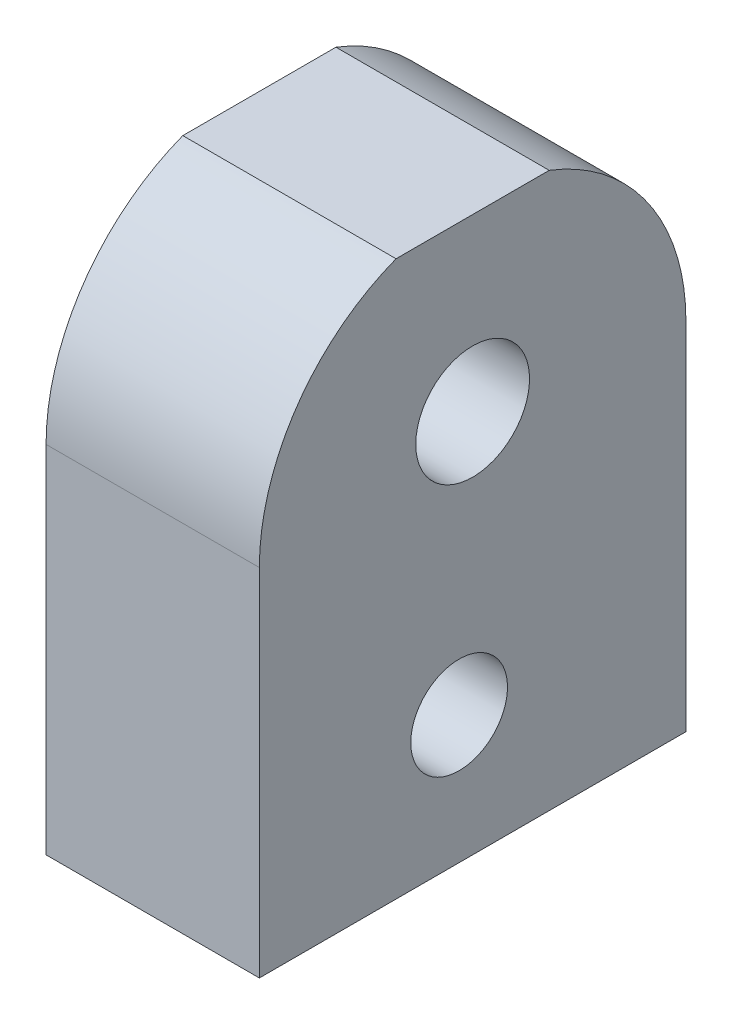
from build123d import *

# Parameters (mm, degrees)
SKETCH_1_W               = 15
SKETCH_1_H               = 30
EXTRUDE_1_DEPTH          = 25
EXTRUDE_3_DEPTH          = 15
SKETCH_4_R               = 1.65
CUT_EXTRUDE_2_DEPTH      = 10
SKETCH_9_R               = 6.1
CUT_EXTRUDE_3_DEPTH      = 6
SKETCH_10_R              = 4
CUT_EXTRUDE_4_DEPTH      = 51.803543184
CUT_EXTRUDE_6_DEPTH      = 53.201532545
CUT_EXTRUDE_6_DEPTH_BACK = 53.201532545
SKETCH_5_R               = 3.4
CUT_EXTRUDE_7_DEPTH      = 52.439284598


with BuildPart() as part:
    # 草图1 → 凸台-拉伸1 (new body)
    with BuildSketch(Plane(origin=(0, 0, 0), x_dir=(1, 0, 0), z_dir=(0, 1, 0))):
        with Locations((7.5, -15)):
            Rectangle(SKETCH_1_W, SKETCH_1_H)
    extrude(amount=EXTRUDE_1_DEPTH)

    # 草图3 → 凸台-拉伸3 (add)
    with BuildSketch(Plane.ZY):
        with BuildLine():
            ThreePointArc((30, 25), (15, 40), (0, 25))
            Line((0, 25), (30, 25))
        make_face()
    extrude(amount=-EXTRUDE_3_DEPTH)

    # 草图4 → 切除-拉伸2 (cut)
    with BuildSketch(Plane.XZ):
        with Locations((7.5, 24)):
            Circle(SKETCH_4_R)
        with Locations((7.5, 6)):
            Circle(SKETCH_4_R)
    extrude(amount=-CUT_EXTRUDE_2_DEPTH, mode=Mode.SUBTRACT)

    # 草图9 → 切除-拉伸3 (cut)
    with BuildSketch(Plane.ZY):
        with Locations((15, 27)):
            Circle(SKETCH_9_R)
    extrude(amount=-CUT_EXTRUDE_3_DEPTH, mode=Mode.SUBTRACT)

    # 草图10 → 切除-拉伸4 (cut, through all)
    with BuildSketch(Plane.ZY.offset(-6)):
        with Locations((15, 27)):
            Circle(SKETCH_10_R)
    extrude(amount=-CUT_EXTRUDE_4_DEPTH, mode=Mode.SUBTRACT)

    # 草图12 → 切除-拉伸6 (cut, two sides: drawn at the far end of the back side and taken through both)
    with BuildSketch(Plane.ZY.offset(-CUT_EXTRUDE_6_DEPTH_BACK)):
        with BuildLine():
            ThreePointArc((20.385164807, 39), (15, 40), (9.614835193, 39))
            Line((9.614835193, 39), (20.385164807, 39))
        make_face()
    extrude(amount=CUT_EXTRUDE_6_DEPTH + CUT_EXTRUDE_6_DEPTH_BACK, mode=Mode.SUBTRACT)

    # 草图5 → 切除-拉伸7 (cut, through all)
    with BuildSketch(Plane.ZY):
        with Locations((15.95, 9)):
            Circle(SKETCH_5_R)
    extrude(amount=-CUT_EXTRUDE_7_DEPTH, mode=Mode.SUBTRACT)


solid = part.part
